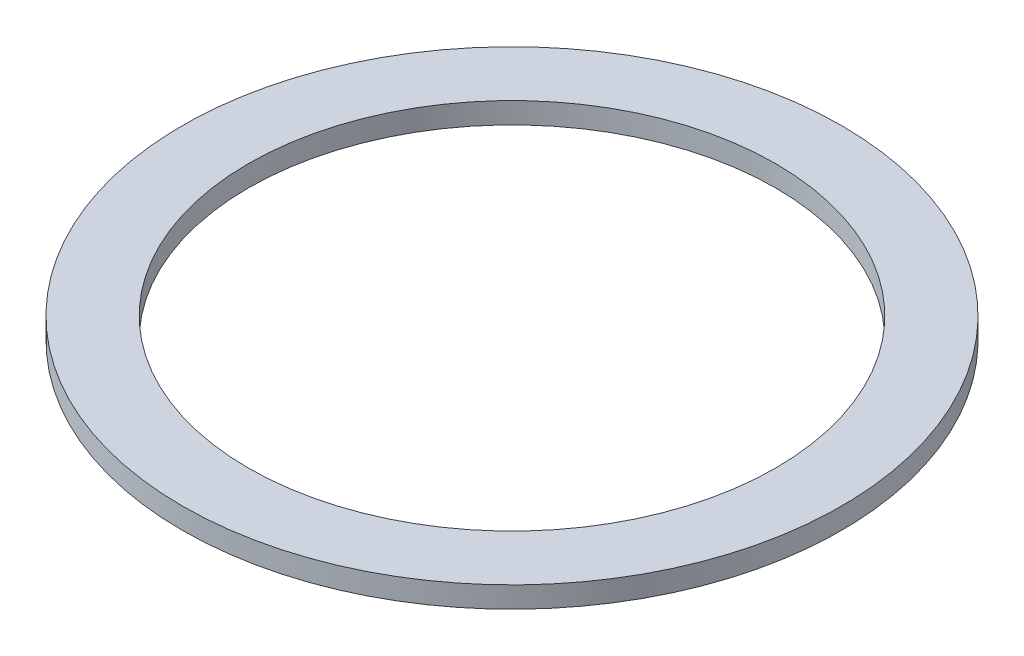
from build123d import *

# Parameters (mm, degrees)
SKETCH1_R           = 62.5
BOSS_EXTRUDE1_DEPTH = 4
SKETCH2_R           = 50
CUT_EXTRUDE1_DEPTH  = 89.478811023


with BuildPart() as part:
    # Sketch1 → Boss-Extrude1 (new body)
    with BuildSketch(Plane(origin=(0, 0, 0), x_dir=(1, 0, 0), z_dir=(0, 1, 0))):
        Circle(SKETCH1_R)
    extrude(amount=BOSS_EXTRUDE1_DEPTH)

    # Sketch2 → Cut-Extrude1 (cut, through all)
    with BuildSketch(Plane(origin=(0, 0, 0), x_dir=(1, 0, 0), z_dir=(0, 1, 0))):
        Circle(SKETCH2_R)
    extrude(amount=CUT_EXTRUDE1_DEPTH, mode=Mode.SUBTRACT)


solid = part.part
